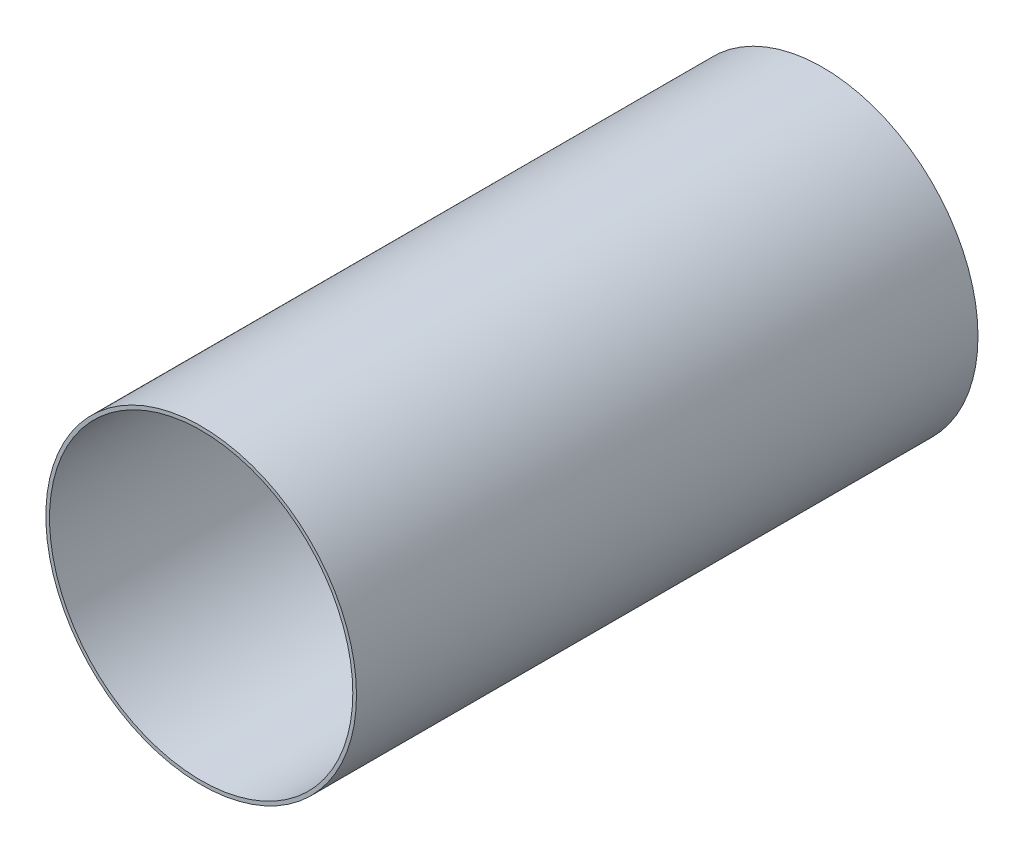
from build123d import *

# Parameters (mm, degrees)
SKETCH1_R           = 63.4746
SKETCH1_R_2         = 61.976
BOSS_EXTRUDE1_DEPTH = 127


with BuildPart() as part:
    # Sketch1 → Boss-Extrude1 (new, symmetric)
    with BuildSketch(Plane.XY):
        Circle(SKETCH1_R)
        Circle(SKETCH1_R_2, mode=Mode.SUBTRACT)
    extrude(amount=BOSS_EXTRUDE1_DEPTH, both=True)


solid = part.part
